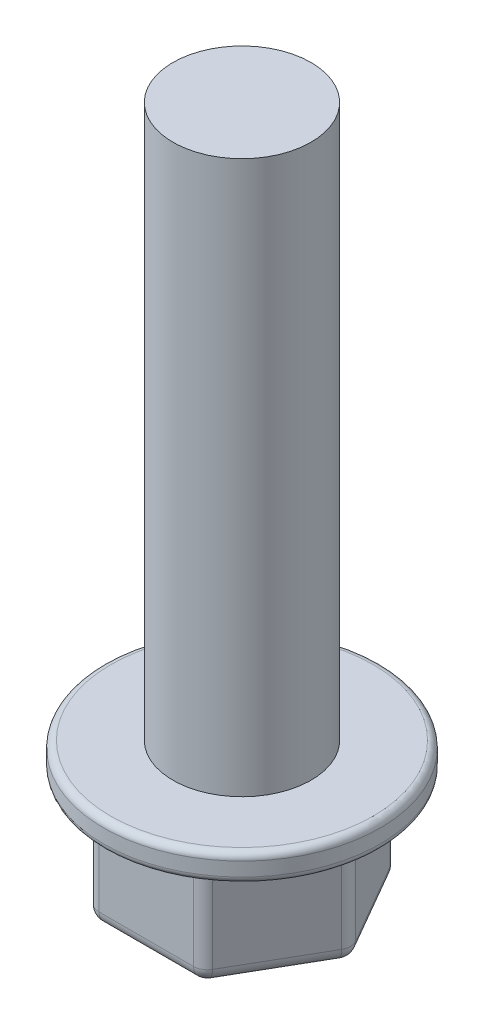
from build123d import *

# Parameters (mm, degrees)
BOSS_EXTRUDE1_DEPTH = 8
CUT_EXTRUDE1_START  = 8
SKETCH2_3_R         = 5.5
SKETCH2_3_R_2       = 3
CUT_EXTRUDE1_DEPTH  = 1
FILLET1_R           = 1
FILLET2_R           = 0.5
FILLET3_R           = 0.5


with BuildPart() as part:
    # Sketch1 → Revolve1 (revolve)
    with BuildSketch(Plane.YZ, mode=Mode.PRIVATE) as revolve1_sk:
        Polygon((0, 5), (40, 5), (40, 0), (-2, 0), (-2, 10), (0, 10), align=None)
    revolve(revolve1_sk.sketch.rotate(Axis((0, -41.785177915, 0), (0, 1, 0)), 180), axis=Axis((0, -41.785177915, 0), (0, 1, 0)))

    # Sketch2 → Boss-Extrude1 (add)
    with BuildSketch(Plane.XZ.offset(2)):
        Polygon((4, -6.92820323), (8, 0), (4, 6.92820323), (-4, 6.92820323), (-8, 0), (-4, -6.92820323), align=None)
    extrude(amount=BOSS_EXTRUDE1_DEPTH)

    # Sketch2<3> → Cut-Extrude1 (cut)
    with BuildSketch(Plane.XZ.offset(2).offset(CUT_EXTRUDE1_START)):
        with Locations(Location((0, 0, 0), (0, 0, 270))):
            Circle(SKETCH2_3_R)
        with Locations(Location((0, 0, 0), (0, 0, 270))):
            Circle(SKETCH2_3_R_2, mode=Mode.SUBTRACT)
    extrude(amount=-CUT_EXTRUDE1_DEPTH, mode=Mode.SUBTRACT)

    # Fillet1
    fillet1_edges = [part.edges().sort_by_distance(p)[0] for p in [
        (0, -2, 6.92820323),
        (4, -6, 6.92820323),
        (-6, -2, 3.464101615),
        (-4, -6, 6.92820323),
        (-6, -2, -3.464101615),
        (-8, -6, 0),
        (0, -2, -6.92820323),
        (-4, -6, -6.92820323),
        (6, -2, -3.464101615),
        (4, -6, -6.92820323),
        (6, -2, 3.464101615),
        (8, -6, 0),
        (0, -10, 6.92820323),
        (-6, -10, 3.464101615),
        (-6, -10, -3.464101615),
        (0, -10, -6.92820323),
        (6, -10, -3.464101615),
        (6, -10, 3.464101615),
    ]]
    fillet(fillet1_edges, radius=FILLET1_R)

    # Fillet2
    fillet2_edges = [part.edges().sort_by_distance(p)[0] for p in [
        (0, -9, 3),
        (0, -10, 5.5),
        (0, -10, 3),
        (0, -2, 10),
        (0, 0, 10),
    ]]
    fillet(fillet2_edges, radius=FILLET2_R - 0.0001)  # a hair under: the kernel refuses the full size

    # Fillet3
    fillet3_edges = [part.edges().sort_by_distance(p)[0] for p in [
        (0, -9, 5.5),
    ]]
    fillet(fillet3_edges, radius=FILLET3_R)


solid = part.part
